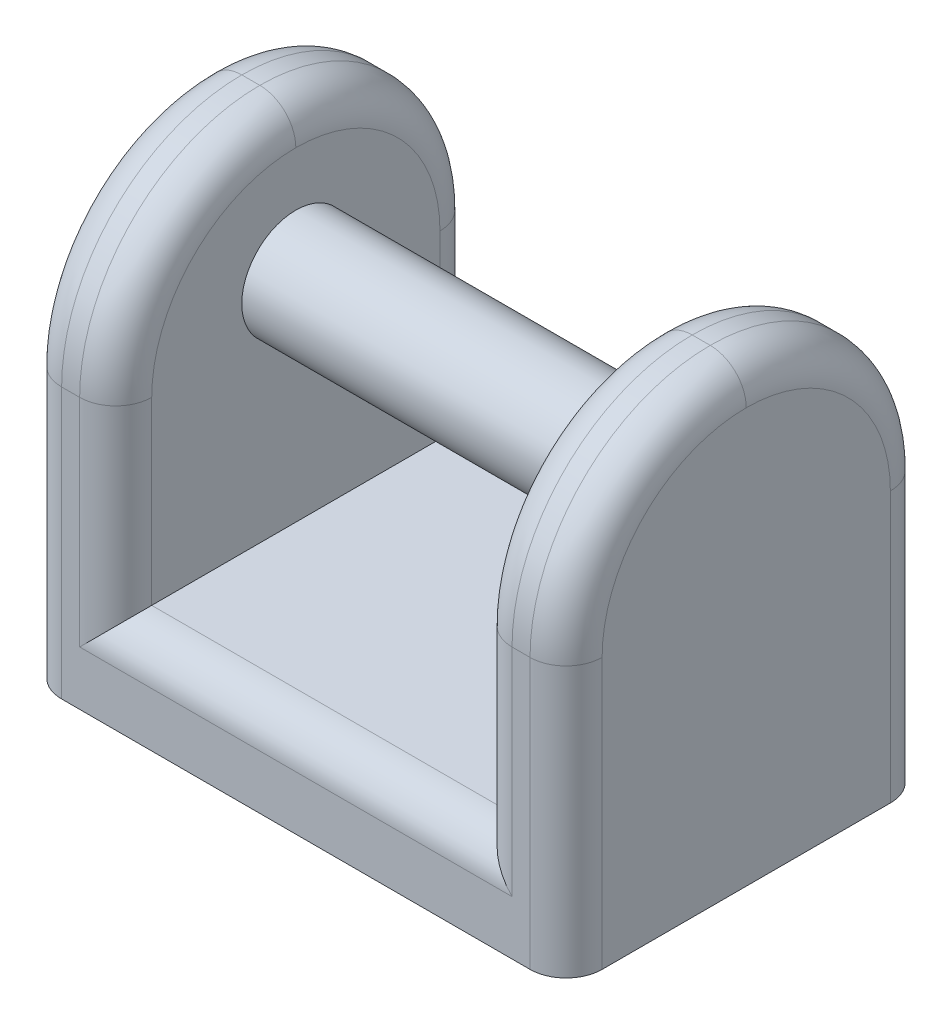
from build123d import *

# Parameters (mm, degrees)
SALIENTE_EXTRUIR1_DEPTH = 50
CROQUIS2_R              = 7.5
SALIENTE_EXTRUIR2_DEPTH = 75
REDONDEO1_R             = 25
REDONDEO2_R             = 5


with BuildPart() as part:
    # Croquis1 → Saliente-Extruir1 (new body)
    with BuildSketch(Plane.XY):
        Polygon((0, 0), (0, 50), (12.5, 50), (12.5, 0), (62.5, 0), (62.5, 50), (75, 50), (75, -12.5), (0, -12.5), align=None)
    extrude(amount=SALIENTE_EXTRUIR1_DEPTH)

    # Croquis2 → Saliente-Extruir2 (add)
    with BuildSketch(Plane(origin=(75, 0, 0), x_dir=(0, 0, -1), z_dir=(1, 0, 0))):
        with Locations(Location((-25, 30, 0), (0, 0, 180))):
            Circle(CROQUIS2_R)
    extrude(amount=-SALIENTE_EXTRUIR2_DEPTH)

    # Redondeo1
    redondeo1_edges = [part.edges().sort_by_distance(p)[0] for p in [
        (6.25, 50, 0),
        (6.25, 50, 50),
        (68.75, 50, 50),
        (68.75, 50, 0),
    ]]
    fillet(redondeo1_edges, radius=REDONDEO1_R - 0.0001)  # a hair under: the kernel refuses the full size

    # Redondeo2
    redondeo2_edges = [part.edges().sort_by_distance(p)[0] for p in [
        (0, 6.25005, 50),
        (0, 6.25005, 0),
        (37.5, 0, 50),
        (62.5, 12.50005, 50),
        (75, 6.25005, 0),
        (12.5, 12.50005, 0),
        (12.5, 12.50005, 50),
        (12.5, 42.677698819, 42.677698819),
        (12.5, 42.677698819, 7.322301181),
        (0, 42.677698819, 42.677698819),
        (0, 42.677698819, 7.322301181),
        (75, 6.25005, 50),
        (75, 42.677698819, 7.322301181),
        (75, 42.677698819, 42.677698819),
        (62.5, 42.677698819, 7.322301181),
        (62.5, 42.677698819, 42.677698819),
        (62.5, 12.50005, 0),
        (37.5, 0, 0),
    ]]
    fillet(redondeo2_edges, radius=REDONDEO2_R)


solid = part.part
